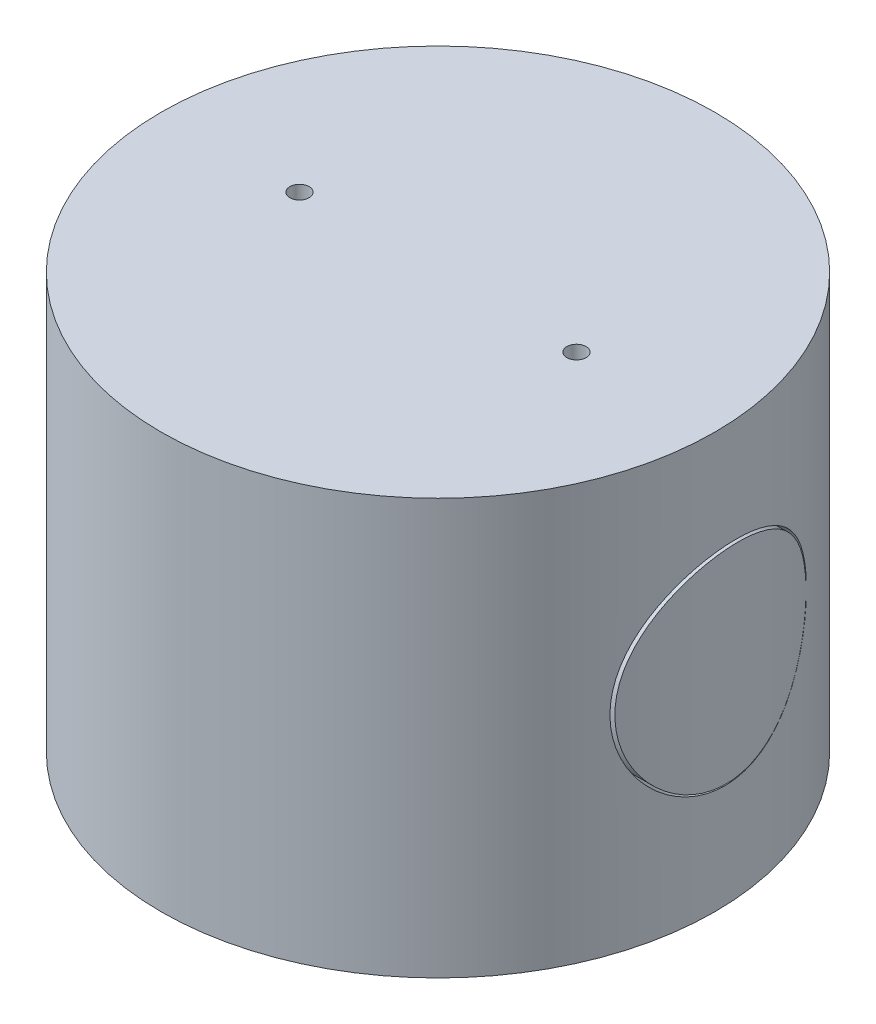
from build123d import *

# Parameters (mm, degrees)
BOSS_EXTRUDE1_DEPTH               = 62.023012247
F_1_4_20_TAPPED_HOLE1_D           = 5.1054
F_1_4_20_TAPPED_HOLE1_DEPTH       = 16.51
F_1_4_20_TAPPED_HOLE1_CSINK_D     = 6.3754
F_1_4_20_TAPPED_HOLE1_CSINK_ANGLE = 90
F_1_4_20_TAPPED_HOLE1_TIP         = 1.533816902
SKETCH11_W                        = 14.690046345
SKETCH11_H                        = 2.54
BOSS_EXTRUDE3_DEPTH               = 65.156264766
SKETCH10_R                        = 9.319627447
BOSS_EXTRUDE4_DEPTH               = 64.578834592
SKETCH13_R                        = 0.884999144
CUT_EXTRUDE2_DEPTH                = 46.345656428
SKETCH15_OUTSIDE_W                = 85.352
SKETCH15_OUTSIDE_H                = 70.996
SKETCH15_OUTSIDE_R                = 25.4
CUT_EXTRUDE3_DEPTH                = 43.434
SKETCH16_R                        = 2.75
CUT_EXTRUDE5_DEPTH                = 8.89


with BuildPart() as part:
    # Sketch2 → Boss-Extrude1 (new body)
    with BuildSketch(Plane(origin=(0, 0, 0), x_dir=(0, 0, -1), z_dir=(1, 0, 0))):
        with BuildLine():
            Line((0, 0), (50.8, 0))
            Line((50.8, 0), (50.8, 17.78))
            Line((50.8, 17.78), (36.109953655, 17.78))
            ThreePointArc((36.109953655, 17.78), (17.145, 19.05), (36.109953655, 20.32))
            Line((36.109953655, 20.32), (50.8, 20.32))
            Line((50.8, 20.32), (50.8, 38.1))
            Line((50.8, 38.1), (0, 38.1))
            Line((0, 38.1), (0, 0))
        make_face()
    extrude(amount=BOSS_EXTRUDE1_DEPTH)

    # 1/4-20 Tapped Hole1
    with Locations(Plane(origin=(0, 0, 0), x_dir=(-1, 0, 0), z_dir=(0, -1, 0))):
        with Locations((-31.011506124, 12.7), (-31.011506124, 38.1)):
            CounterSinkHole(F_1_4_20_TAPPED_HOLE1_D / 2, F_1_4_20_TAPPED_HOLE1_CSINK_D / 2, depth=F_1_4_20_TAPPED_HOLE1_DEPTH, counter_sink_angle=F_1_4_20_TAPPED_HOLE1_CSINK_ANGLE)
            with Locations((0, 0, -(F_1_4_20_TAPPED_HOLE1_DEPTH + F_1_4_20_TAPPED_HOLE1_TIP / 2))):  # 118° drill point
                Cone(0, F_1_4_20_TAPPED_HOLE1_D / 2, F_1_4_20_TAPPED_HOLE1_TIP, mode=Mode.SUBTRACT)

    # Sketch11 → Boss-Extrude3 (add)
    with BuildSketch(Plane.ZY):
        with Locations((-43.454976828, 19.05)):
            Rectangle(SKETCH11_W, SKETCH11_H)
    extrude(amount=-BOSS_EXTRUDE3_DEPTH)

    # Sketch10 → Boss-Extrude4 (add)
    with BuildSketch(Plane(origin=(0, -2.659795234, 0), x_dir=(0, 0, 1), z_dir=(-1, 0, 0))):
        with Locations((-26.802286556, 21.590488848)):
            Circle(SKETCH10_R)
    extrude(amount=-BOSS_EXTRUDE4_DEPTH)

    # Sketch13 → Cut-Extrude2 (cut)
    with BuildSketch(Plane(origin=(0, 38.1, 0), x_dir=(1, 0, 0), z_dir=(0, 1, 0))):
        with Locations((18.311506124, 25.4)):
            Circle(SKETCH13_R)
        with Locations((43.711506124, 25.4)):
            Circle(SKETCH13_R)
    extrude(amount=-CUT_EXTRUDE2_DEPTH, mode=Mode.SUBTRACT)

    # Sketch15 outside → Cut-Extrude3 (cut)
    with BuildSketch(Plane(origin=(0, 38.1, 0), x_dir=(1, 0, 0), z_dir=(0, 1, 0))):
        with Locations((32.578, 25.4)):
            Rectangle(SKETCH15_OUTSIDE_W, SKETCH15_OUTSIDE_H)
        with Locations((31.011506124, 25.4)):
            Circle(SKETCH15_OUTSIDE_R, mode=Mode.SUBTRACT)
    extrude(amount=-CUT_EXTRUDE3_DEPTH, mode=Mode.SUBTRACT)

    # Sketch16 → Cut-Extrude5 (cut)
    with BuildSketch(Plane(origin=(0, 0, 0), x_dir=(-1, 0, 0), z_dir=(0, -1, 0))):
        with Locations((-43.711506124, 25.4)):
            Circle(SKETCH16_R)
        with Locations((-18.311506124, 25.4)):
            Circle(SKETCH16_R)
    extrude(amount=-CUT_EXTRUDE5_DEPTH, mode=Mode.SUBTRACT)


solid = part.part
